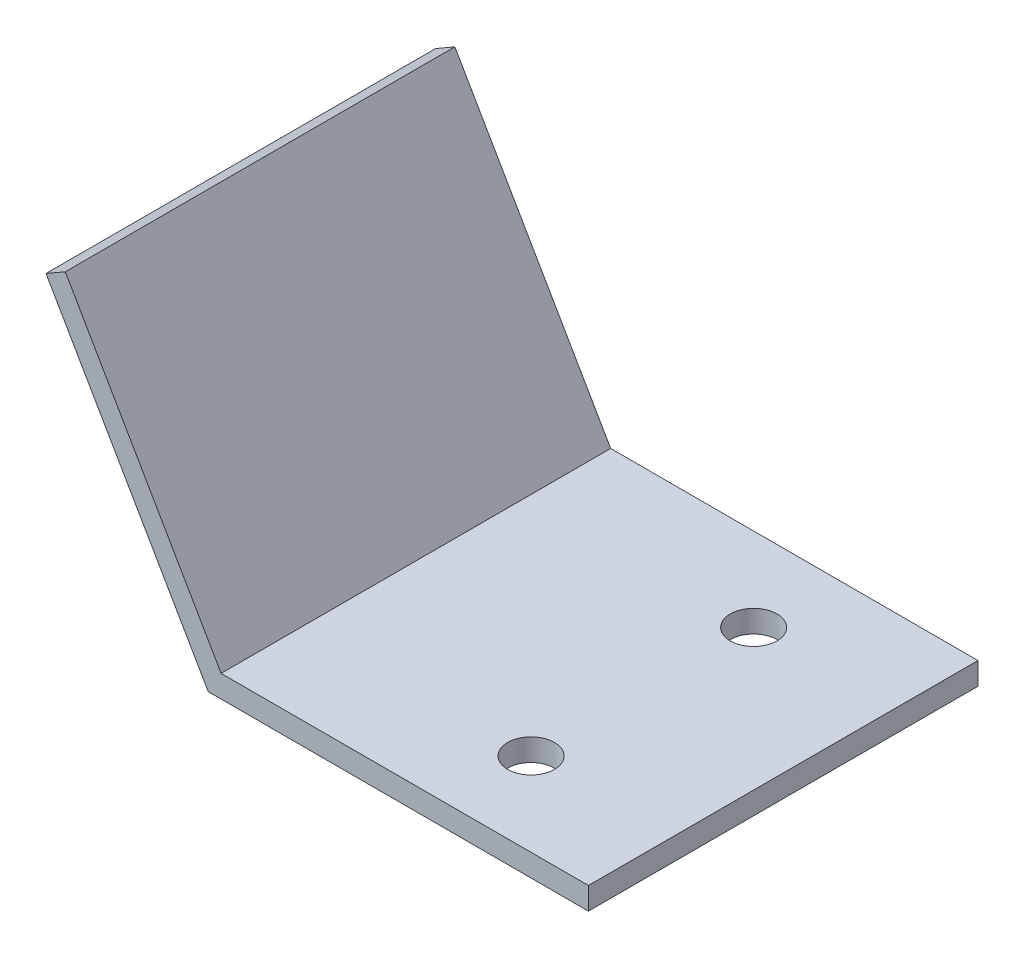
from build123d import *

# Parameters (mm, degrees)
EXTRUDE_3_DEPTH     = 35
SKETCH_3_R          = 2.1
CUT_EXTRUDE_1_DEPTH = 56.502598264
SKETCH_4_R          = 5
CUT_EXTRUDE_2_DEPTH = 1.7


with BuildPart() as part:
    # 草图1 → 凸台-拉伸3 (new body)
    with BuildSketch(Plane.XY):
        Polygon((0, 0), (34.154700538, 0), (34.154700538, 2), (1.154700538, 2), (-12.845299462, 26.248711306), (-14.577350269, 25.248711306), align=None)
    extrude(amount=EXTRUDE_3_DEPTH)

    # 草图3 → 切除-拉伸1 (cut, through all)
    with BuildSketch(Plane.XZ):
        with Locations((21.5, 27.5)):
            Circle(SKETCH_3_R)
        with Locations((21.5, 7.5)):
            Circle(SKETCH_3_R)
    extrude(amount=-CUT_EXTRUDE_1_DEPTH, mode=Mode.SUBTRACT)

    # 草图4 → 切除-拉伸2 (cut)
    with BuildSketch(Plane(origin=(0, 0, 0), x_dir=(0, 0, 1), z_dir=(-0.8660254037844397, -0.499999999999998, 0))):
        with Locations((27.5, 15)):
            Circle(SKETCH_4_R)
        with Locations((7.5, 15)):
            Circle(SKETCH_4_R)
    extrude(amount=-CUT_EXTRUDE_2_DEPTH, mode=Mode.SUBTRACT)


solid = part.part
